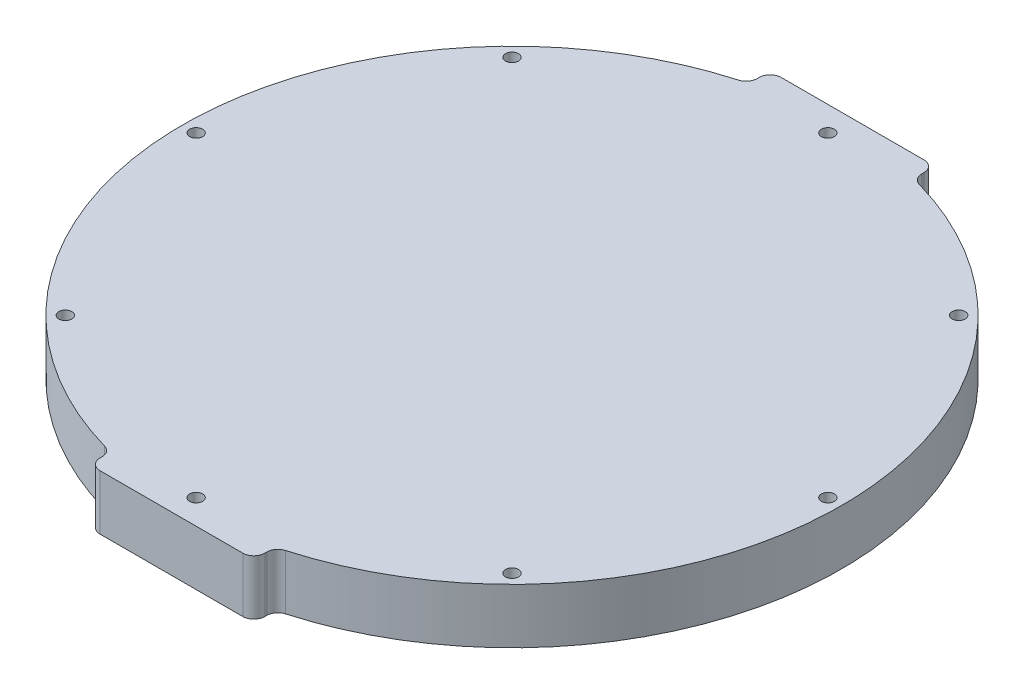
from build123d import *

# Parameters (mm, degrees)
SKETCH2_R                = 76.2
BOSS_EXTRUDE1_DEPTH      = 12.7
BOSS_EXTRUDE2_DEPTH      = 78.74
BOSS_EXTRUDE2_DEPTH_BACK = 78.74
FILLET1_R                = 2.54
SKETCH4_R                = 1.50114
CUT_EXTRUDE1_DEPTH       = 111.307377813


with BuildPart() as part:
    # Sketch2 → Boss-Extrude1 (new body)
    with BuildSketch(Plane(origin=(0, 0, 0), x_dir=(1, 0, 0), z_dir=(0, 1, 0))):
        Circle(SKETCH2_R)
    extrude(amount=BOSS_EXTRUDE1_DEPTH)

    # Sketch3 → Boss-Extrude2 (add, two sides: drawn at the far end of the back side and taken through both)
    with BuildSketch(Plane.XY.offset(-BOSS_EXTRUDE2_DEPTH_BACK)):
        Polygon((0, 0), (-19.05, 0), (-19.05, 12.7), (19.05, 12.7), (19.05, 0), align=None)
    extrude(amount=BOSS_EXTRUDE2_DEPTH + BOSS_EXTRUDE2_DEPTH_BACK)

    # Fillet1
    fillet1_edges = [part.edges().sort_by_distance(p)[0] for p in [
        (19.05, 6.35, 73.780332745),
        (19.05, 6.35, 78.74),
        (-19.05, 6.35, 73.780332745),
        (-19.05, 6.35, 78.74),
        (-19.05, 6.35, -73.780332745),
        (-19.05, 6.35, -78.74),
        (19.05, 6.35, -73.780332745),
        (19.05, 6.35, -78.74),
    ]]
    fillet(fillet1_edges, radius=FILLET1_R)

    # Sketch4 → Cut-Extrude1 (cut, through all)
    with BuildSketch(Plane(origin=(0, 12.7, 0), x_dir=(1, 0, 0), z_dir=(0, 1, 0))):
        with Locations((73.025, 0)):
            Circle(SKETCH4_R)
        with Locations((51.636472696, -51.636472696)):
            Circle(SKETCH4_R)
        with Locations((0, -73.025)):
            Circle(SKETCH4_R)
        with Locations((-51.636472696, -51.636472696)):
            Circle(SKETCH4_R)
        with Locations((-73.025, 0)):
            Circle(SKETCH4_R)
        with Locations((-51.636472696, 51.636472696)):
            Circle(SKETCH4_R)
        with Locations((0, 73.025)):
            Circle(SKETCH4_R)
        with Locations((51.636472696, 51.636472696)):
            Circle(SKETCH4_R)
    extrude(amount=-CUT_EXTRUDE1_DEPTH, mode=Mode.SUBTRACT)


solid = part.part
